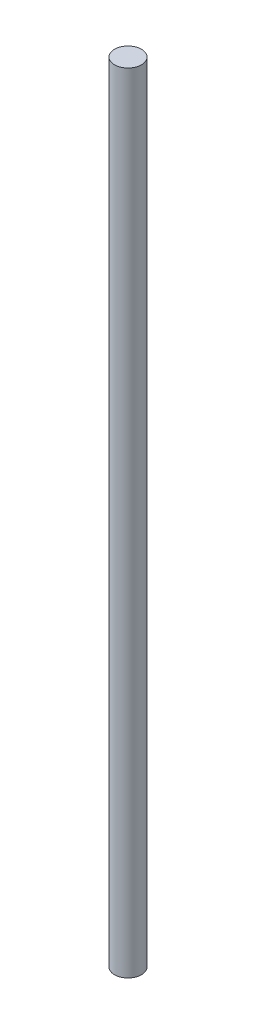
from build123d import *

# Parameters (mm, degrees)
SKETCH1_R           = 0.855
BOSS_EXTRUDE1_DEPTH = 25


with BuildPart() as part:
    # Sketch1 → Boss-Extrude1 (new, symmetric)
    with BuildSketch(Plane(origin=(0, 0, 0), x_dir=(1, 0, 0), z_dir=(0, 1, 0))):
        Circle(SKETCH1_R)
    extrude(amount=BOSS_EXTRUDE1_DEPTH, both=True)


solid = part.part
